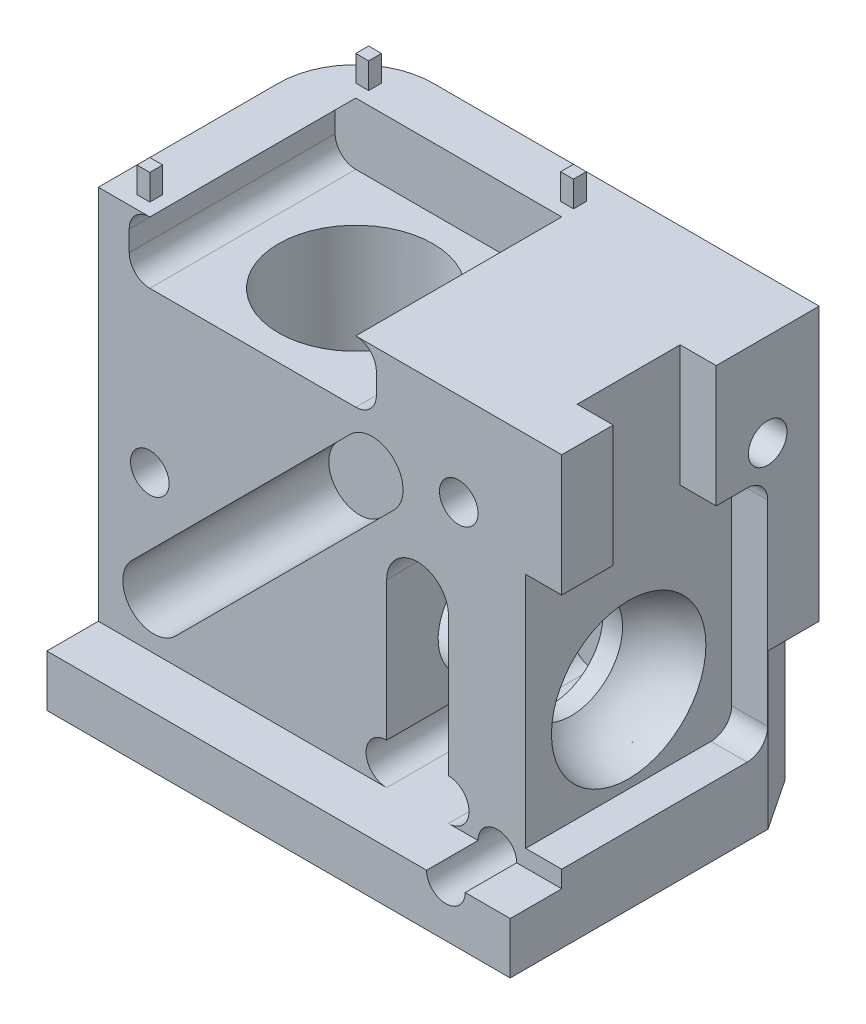
from build123d import *

# Parameters (mm, degrees)
SKETCH1_W                       = 9
SKETCH1_H                       = 6
MAIN_BODY_EXT_DEPTH             = 8.3
EMISSION_PATH_EXT_DEPTH         = 9
SKETCH3_R                       = 1.25
EMISSION_AND_GRIN_CUT_DEPTH     = 19.125672401
SKETCH4_R                       = 1
DRUM_LENS_CUT_DEPTH             = 7
SKETCH5_W                       = 9
SKETCH5_H                       = 7.3
FILTERSET_CUT1_DEPTH            = 1
FILTERSET_CUT2_DEPTH            = 4
SKETCH10_R                      = 2.5
EMISSION_LENS_CUT_DEPTH         = 8.5
SKETCH15_R                      = 0.795
MAGNETS_CUT_DEPTH               = 0.9
SCREW_HOLES_CUT_DEPTH           = 19.561788707
SCREW_HOLES_CUT_DEPTH_BACK      = 3
SKETCH18_R                      = 0.375
EXTERNAL_FILLET_1_R             = 1.5
CUT_EXTRUDE8_DEPTH              = 12.545128843
CUT_EXTRUDE8_DEPTH_BACK         = 4
SKETCH28_R                      = 1.5
CUT_EXTRUDE9_DEPTH              = 3
CUT_EXTRUDE10_DEPTH             = 0.7
SKETCH29_R                      = 0.375
CUT_EXTRUDE11_DEPTH             = 2.5
SKETCH32_W                      = 2
SKETCH32_H                      = 2.36
CUT_EXTRUDE14_DEPTH             = 0.7
CUT_EXTRUDE16_DEPTH             = 9
CUT_EXTRUDE17_REACH             = 12.329
SKETCH37_R                      = 2
CUT_EXTRUDE18_START             = -9
CUT_EXTRUDE18_DEPTH             = 9
CUT_EXTRUDE19_REACH             = 20.126
SKETCH39_W                      = 5.765434423
SKETCH39_H                      = 9
CUT_EXTRUDE19_DIRECTION_2_REACH = 20.126
SKETCH40_W                      = 0.25
SKETCH40_H                      = 0.25
BOSS_EXTRUDE1_DEPTH             = 0.5


with BuildPart() as part:
    # Sketch1 → Main Body Ext (new body)
    with BuildSketch(Plane(origin=(0, 0, 0), x_dir=(1, 0, 0), z_dir=(0, 1, 0))):
        Rectangle(SKETCH1_W, SKETCH1_H)
    extrude(amount=MAIN_BODY_EXT_DEPTH)

    # Sketch8 → Emission Path Ext (add)
    with BuildSketch(Plane(origin=(0, 8.3, 0), x_dir=(1, 0, 0), z_dir=(0, 1, 0))):
        Polygon((0.25, 3), (1.5, 1.75), (1.5, -3), (-4.5, -3), (-4.5, 3), align=None)
    extrude(amount=EMISSION_PATH_EXT_DEPTH)

    # Sketch3 → Emission and Grin Cut (cut, through all)
    with BuildSketch(Plane.XZ):
        with Locations(Location((-1.5, 0, 0), (0, 0, 270))):
            Circle(SKETCH3_R)
    extrude(amount=-EMISSION_AND_GRIN_CUT_DEPTH, mode=Mode.SUBTRACT)

    # Sketch4 → Drum Lens Cut (cut)
    with BuildSketch(Plane(origin=(4.5, 0, 0), x_dir=(0, 0, -1), z_dir=(1, 0, 0))):
        with Locations((0, 3)):
            Circle(SKETCH4_R)
    extrude(amount=-DRUM_LENS_CUT_DEPTH, mode=Mode.SUBTRACT)

    # Sketch5 → FilterSet Cut1 (cut)
    with BuildSketch(Plane.XY.offset(3)):
        with Locations((0, 4.65)):
            Rectangle(SKETCH5_W, SKETCH5_H)
    extrude(amount=-FILTERSET_CUT1_DEPTH, mode=Mode.SUBTRACT)

    # Sketch6 → FilterSet Cut2 (cut)
    with BuildSketch(Plane.XY.offset(2)):
        with BuildLine():
            Line((2.3, 4.5), (2.3, 1.8))
            ThreePointArc((2.3, 1.8), (2.7, 1.4), (2.3, 1))
            Line((2.3, 1), (1.1, 1))
            ThreePointArc((1.1, 1), (0.7, 1.4), (1.1, 1.8))
            Line((1.1, 1.8), (1.1, 4.5))
            ThreePointArc((1.1, 4.5), (1.7, 5.1), (2.3, 4.5))
        make_face()
        with BuildLine():
            Line((-3.9, 7.9), (-3.9, 7.5))
            ThreePointArc((-3.9, 7.5), (-3.782842712, 7.217157288), (-3.5, 7.1))
            Line((-3.5, 7.1), (0.5, 7.1))
            ThreePointArc((0.5, 7.1), (0.782842712, 7.217157288), (0.9, 7.5))
            Line((0.9, 7.5), (0.9, 7.9))
            ThreePointArc((0.9, 7.9), (0.782842712, 8.182842712), (0.5, 8.3))
            Line((0.5, 8.3), (-3.5, 8.3))
            ThreePointArc((-3.5, 8.3), (-3.782842712, 8.182842712), (-3.9, 7.9))
        make_face()
        with BuildLine():
            Line((0.39411255, 6.591168825), (-3.848528137, 2.348528137))
            ThreePointArc((-3.848528137, 2.348528137), (-3.848528137, 1.5), (-3, 1.5))
            Line((-3, 1.5), (1.242640687, 5.742640687))
            ThreePointArc((1.242640687, 5.742640687), (1.242640687, 6.591168825), (0.39411255, 6.591168825))
        make_face()
    extrude(amount=-FILTERSET_CUT2_DEPTH, mode=Mode.SUBTRACT)

    # Sketch10 → Emission Lens Cut (cut)
    with BuildSketch(Plane(origin=(0, 17.3, 0), x_dir=(1, 0, 0), z_dir=(0, 1, 0))):
        with Locations(Location((-1.5, 0, 0), (0, 0, 270))):
            Circle(SKETCH10_R)
    extrude(amount=-EMISSION_LENS_CUT_DEPTH, mode=Mode.SUBTRACT)

    # Sketch15 → Magnets Cut (cut)
    with BuildSketch(Plane.XZ):
        with Locations(Location((-3.25, -1.875, 0), (0, 0, 270))):
            Circle(SKETCH15_R)
        with Locations(Location((-3.25, 1.875, 0), (0, 0, 270))):
            Circle(SKETCH15_R)
        with Locations(Location((1.5, 0, 0), (0, 0, 270))):
            Circle(SKETCH15_R)
    extrude(amount=-MAGNETS_CUT_DEPTH, mode=Mode.SUBTRACT)

    # Sketch18 → Screw Holes Cut (cut, two sides: drawn at the far end of the back side and taken through both)
    with BuildSketch(Plane.XY.offset(2).offset(-SCREW_HOLES_CUT_DEPTH_BACK)):
        with Locations(Location((-3.5, 4, 0), (0, 0, 180))):
            Circle(SKETCH18_R)
        with Locations(Location((2.5, 6.5, 0), (0, 0, 180))):
            Circle(SKETCH18_R)
        with Locations((3.25, 1)):
            Circle(SKETCH18_R)
    extrude(amount=SCREW_HOLES_CUT_DEPTH + SCREW_HOLES_CUT_DEPTH_BACK, mode=Mode.SUBTRACT)

    # External Fillet 1
    # the kernel refuses this fillet: 1.5 mm, written as the material it takes off along each edge
    with BuildSketch(Plane(origin=(-4.5, -3.75, -3), x_dir=(1, 0, 0), z_dir=(0, 1, 0))) as external_fillet_1_piece_1:
        with BuildLine():
            CenterArc((EXTERNAL_FILLET_1_R, -EXTERNAL_FILLET_1_R), EXTERNAL_FILLET_1_R, 90, 90)
            Line((0, -EXTERNAL_FILLET_1_R), (0, 0))
            Line((0, 0), (EXTERNAL_FILLET_1_R, 0))
        make_face()
    extrude(amount=24.8, mode=Mode.SUBTRACT)
    with BuildSketch(Plane(origin=(1.5, 8.3, 3), x_dir=(0, 0, -1), z_dir=(0, 1, 0))) as external_fillet_1_piece_2:
        with BuildLine():
            CenterArc((EXTERNAL_FILLET_1_R, EXTERNAL_FILLET_1_R), EXTERNAL_FILLET_1_R, 180, 90)
            Line((0, EXTERNAL_FILLET_1_R), (0, 0))
            Line((0, 0), (EXTERNAL_FILLET_1_R, 0))
        make_face()
    extrude(amount=12.75, mode=Mode.SUBTRACT)

    # Sketch28 → Cut-Extrude8 (cut, two sides: drawn at the far end of the back side and taken through both)
    with BuildSketch(Plane(origin=(0, 7.1, 0), x_dir=(1, 0, 0), z_dir=(0, 1, 0)).offset(-CUT_EXTRUDE8_DEPTH_BACK)):
        with Locations(Location((-1.5, 0, 0), (0, 0, 180))):
            Circle(SKETCH28_R)
    extrude(amount=CUT_EXTRUDE8_DEPTH + CUT_EXTRUDE8_DEPTH_BACK, mode=Mode.SUBTRACT)

    # Sketch14 → Cut-Extrude9 (cut)
    with BuildSketch(Plane.XZ):
        Polygon((4.5, -3), (4.5, -2.006698359), (3.837798906, -3), align=None)
    extrude(amount=-CUT_EXTRUDE9_DEPTH, mode=Mode.SUBTRACT)

    # Sketch12 → Cut-Extrude10 (cut)
    with BuildSketch(Plane(origin=(4.5, 0, 0), x_dir=(0, 0, -1), z_dir=(1, 0, 0))):
        with BuildLine():
            Line((1.6, 5.94), (-1.6, 5.94))
            Line((-1.6, 5.94), (-2, 5.94))
            Line((-2, 5.94), (-2, 1.33))
            Line((-2, 1.33), (1.6, 1.33))
            ThreePointArc((1.6, 1.33), (1.882842712, 1.447157288), (2, 1.73))
            Line((2, 1.73), (2, 5.54))
            ThreePointArc((2, 5.54), (1.882842712, 5.822842712), (1.6, 5.94))
        make_face()
    extrude(amount=-CUT_EXTRUDE10_DEPTH, mode=Mode.SUBTRACT)

    # Sketch29 → Cut-Extrude11 (cut)
    with BuildSketch(Plane(origin=(4.5, 0, 0), x_dir=(0, 0, -1), z_dir=(1, 0, 0))):
        with Locations((2, 6.5)):
            Circle(SKETCH29_R)
    extrude(amount=-CUT_EXTRUDE11_DEPTH, mode=Mode.SUBTRACT)

    # Sketch32 → Cut-Extrude14 (cut)
    with BuildSketch(Plane(origin=(4.5, 0, 0), x_dir=(0, 0, -1), z_dir=(1, 0, 0))):
        with Locations((0, 7.12)):
            Rectangle(SKETCH32_W, SKETCH32_H)
    extrude(amount=-CUT_EXTRUDE14_DEPTH, mode=Mode.SUBTRACT)

    # Sketch33 → Cut-Revolve1 (revolve, cut)
    with BuildSketch(Plane.XY, mode=Mode.PRIVATE) as cut_revolve1_sk:
        with BuildLine():
            Line((3.8, 3), (2.3, 3))
            ThreePointArc((2.3, 3), (2.739339828, 4.060660172), (3.8, 4.5))
            Line((3.8, 4.5), (3.8, 3))
        make_face()
    revolve(cut_revolve1_sk.sketch.rotate(Axis((3.8, 3, 0), (-1, 0, 0)), 90), axis=Axis((3.8, 3, 0), (-1, 0, 0)), mode=Mode.SUBTRACT)

    # Sketch36 → Cut-Extrude16 (cut)
    with BuildSketch(Plane(origin=(0, 17.3, 0), x_dir=(1, 0, 0), z_dir=(0, 1, 0))):
        with BuildLine():
            Line((-4.5, -1.5), (-4.5, -3))
            Line((-4.5, -3), (-3, -3))
            ThreePointArc((-3, -3), (-4.060660172, -2.560660172), (-4.5, -1.5))
        make_face()
    extrude(amount=-CUT_EXTRUDE16_DEPTH, mode=Mode.SUBTRACT)

    # Sketch37 → Cut-Extrude17 (cut, up to next)
    with BuildSketch(Plane(origin=(0, 8.8, 0), x_dir=(1, 0, 0), z_dir=(0, 1, 0)), mode=Mode.PRIVATE) as cut_extrude17_sk1:
        with Locations(Location((-1.5, 0, 0), (0, 0, 180))):
            Circle(SKETCH37_R)
    cut_extrude17_tool1 = extrude(cut_extrude17_sk1.sketch, amount=-CUT_EXTRUDE17_REACH, mode=Mode.PRIVATE) & part.part
    add(cut_extrude17_tool1.solids().sort_by_distance((-1.5, 8.8, 0))[0], mode=Mode.SUBTRACT)

    # Sketch38 → Cut-Extrude18 (cut)
    with BuildSketch(Plane(origin=(0, 17.3, 0), x_dir=(1, 0, 0), z_dir=(0, 1, 0)).offset(CUT_EXTRUDE18_START)):
        with BuildLine():
            Line((-3, 3), (0.25, 3))
            Line((0.25, 3), (1.5, 1.75))
            Line((1.5, 1.75), (1.5, -1.5))
            ThreePointArc((1.5, -1.5), (1.060660172, -2.560660172), (0, -3))
            Line((0, -3), (-3, -3))
            ThreePointArc((-3, -3), (-4.060660172, -2.560660172), (-4.5, -1.5))
            Line((-4.5, -1.5), (-4.5, 1.5))
            ThreePointArc((-4.5, 1.5), (-4.060660172, 2.560660172), (-3, 3))
        make_face()
        with BuildLine():
            Line((-4.375, -1.5), (-4.375, 1.5))
            ThreePointArc((-4.375, 1.5), (-3.940482173, 2.440482173), (-3, 2.875))
            Line((-3, 2.875), (0.25, 2.875))
            Line((0.25, 2.875), (1.375, 1.75))
            Line((1.375, 1.75), (1.375, -1.5))
            ThreePointArc((1.375, -1.5), (0.972271824, -2.472271824), (0, -2.875))
            Line((0, -2.875), (-3, -2.875))
            ThreePointArc((-3, -2.875), (-3.972271824, -2.472271824), (-4.375, -1.5))
        make_face(mode=Mode.SUBTRACT)
    extrude(amount=CUT_EXTRUDE18_DEPTH, mode=Mode.SUBTRACT)

    # Cut-Extrude19: up to this face of the body (flat: up to its plane)
    cut_extrude19_end = Plane(part.part.faces().sort_by_distance((-1.375, 12.8, -2.875))[0])
    # Sketch39 → Cut-Extrude19 (cut, up to the picked face)
    with BuildSketch(Plane.XY, mode=Mode.PRIVATE) as cut_extrude19_sk1:
        with Locations((-1.507717212, 12.8)):
            Rectangle(SKETCH39_W, SKETCH39_H)
    cut_extrude19_tool1 = split(extrude(cut_extrude19_sk1.sketch, amount=-CUT_EXTRUDE19_REACH, mode=Mode.PRIVATE), bisect_by=cut_extrude19_end, keep=Keep.BOTH, mode=Mode.PRIVATE)
    add(cut_extrude19_tool1.solids().sort_by(Axis((-1.507717, 12.8, 0), (0, 0, -1)))[0], mode=Mode.SUBTRACT)

    # Cut-Extrude19 direction 2: up to this face of the body (flat: up to its plane)
    cut_extrude19_direction_2_end = Plane(part.part.faces().sort_by_distance((-1.5, 12.8, 2.875))[0])
    # Sketch39 → Cut-Extrude19 direction 2 (cut, up to the picked face)
    with BuildSketch(Plane.XY, mode=Mode.PRIVATE) as cut_extrude19_direction_2_sk1:
        with Locations((-1.507717212, 12.8)):
            Rectangle(SKETCH39_W, SKETCH39_H)
    cut_extrude19_direction_2_tool1 = split(extrude(cut_extrude19_direction_2_sk1.sketch, amount=CUT_EXTRUDE19_DIRECTION_2_REACH, mode=Mode.PRIVATE), bisect_by=cut_extrude19_direction_2_end, keep=Keep.BOTH, mode=Mode.PRIVATE)
    add(cut_extrude19_direction_2_tool1.solids().sort_by(Axis((-1.507717, 12.8, 0), (0, 0, 1)))[0], mode=Mode.SUBTRACT)

    # Sketch40 → Boss-Extrude1 (add)
    with BuildSketch(Plane(origin=(0, 8.3, 0), x_dir=(1, 0, 0), z_dir=(0, 1, 0))):
        with Locations((-3.625, 2.375)):
            Rectangle(SKETCH40_W, SKETCH40_H)
        with Locations((0.353060916, 2.375)):
            Rectangle(SKETCH40_W, SKETCH40_H)
        with Locations((-3.875, -1.625)):
            Rectangle(SKETCH40_W, SKETCH40_H)
    extrude(amount=BOSS_EXTRUDE1_DEPTH)


solid = part.part
